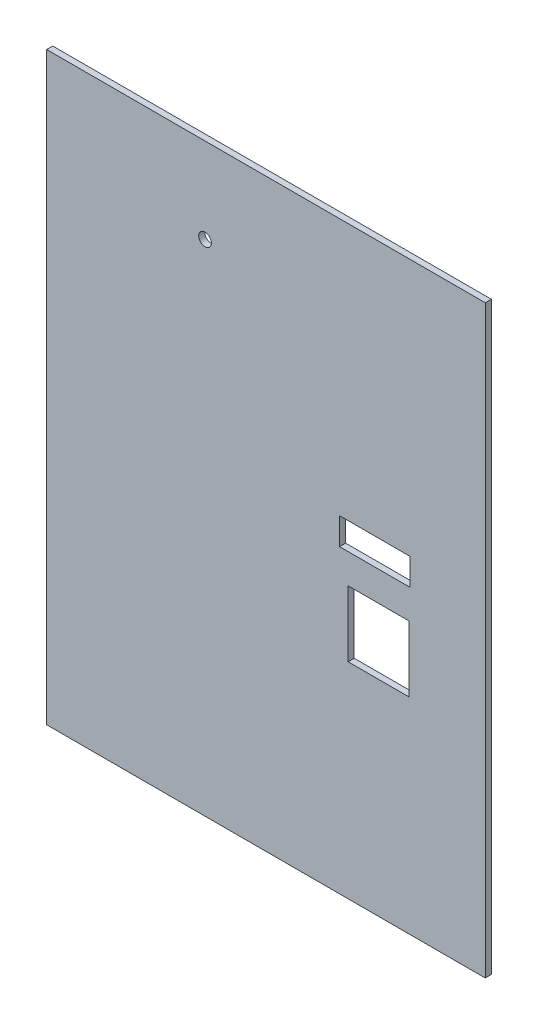
from build123d import *

# Parameters (mm, degrees)
SKETCH1_W           = 457.2
SKETCH1_H           = 609.6
BOSS_EXTRUDE2_DEPTH = 6.35
CUT_EXTRUDE1_REACH  = 764.026
SKETCH2_W           = 63.5
SKETCH2_H           = 68.58
SKETCH3_W           = 73.66
SKETCH3_H           = 27.94
CUT_EXTRUDE2_DEPTH  = 63.5
SKETCH4_R           = 6.604
CUT_EXTRUDE3_DEPTH  = 6.35


with BuildPart() as part:
    # Sketch1 → Boss-Extrude2 (new body)
    with BuildSketch(Plane.XY):
        with Locations((-228.6, 304.8)):
            Rectangle(SKETCH1_W, SKETCH1_H)
    extrude(amount=BOSS_EXTRUDE2_DEPTH)

    # Sketch2 → Cut-Extrude1 (cut, up to next)
    with BuildSketch(Plane.XY.offset(6.35), mode=Mode.PRIVATE) as cut_extrude1_sk1:
        with Locations((-111.175624359, 248.287614127)):
            Rectangle(SKETCH2_W, SKETCH2_H)
    cut_extrude1_tool1 = extrude(cut_extrude1_sk1.sketch, amount=-CUT_EXTRUDE1_REACH, mode=Mode.PRIVATE) & part.part
    add(cut_extrude1_tool1.solids().sort_by_distance((-111.175624, 248.287614, 6.35))[0], mode=Mode.SUBTRACT)

    # Sketch3 → Cut-Extrude2 (cut)
    with BuildSketch(Plane.XY.offset(6.35)):
        with Locations((-115.023623847, 327.440976048)):
            Rectangle(SKETCH3_W, SKETCH3_H)
    extrude(amount=-CUT_EXTRUDE2_DEPTH, mode=Mode.SUBTRACT)

    # Sketch4 → Cut-Extrude3 (cut)
    with BuildSketch(Plane.XY.offset(6.35)):
        with Locations((-292.1, 520.7)):
            Circle(SKETCH4_R)
    extrude(amount=-CUT_EXTRUDE3_DEPTH, mode=Mode.SUBTRACT)


solid = part.part
